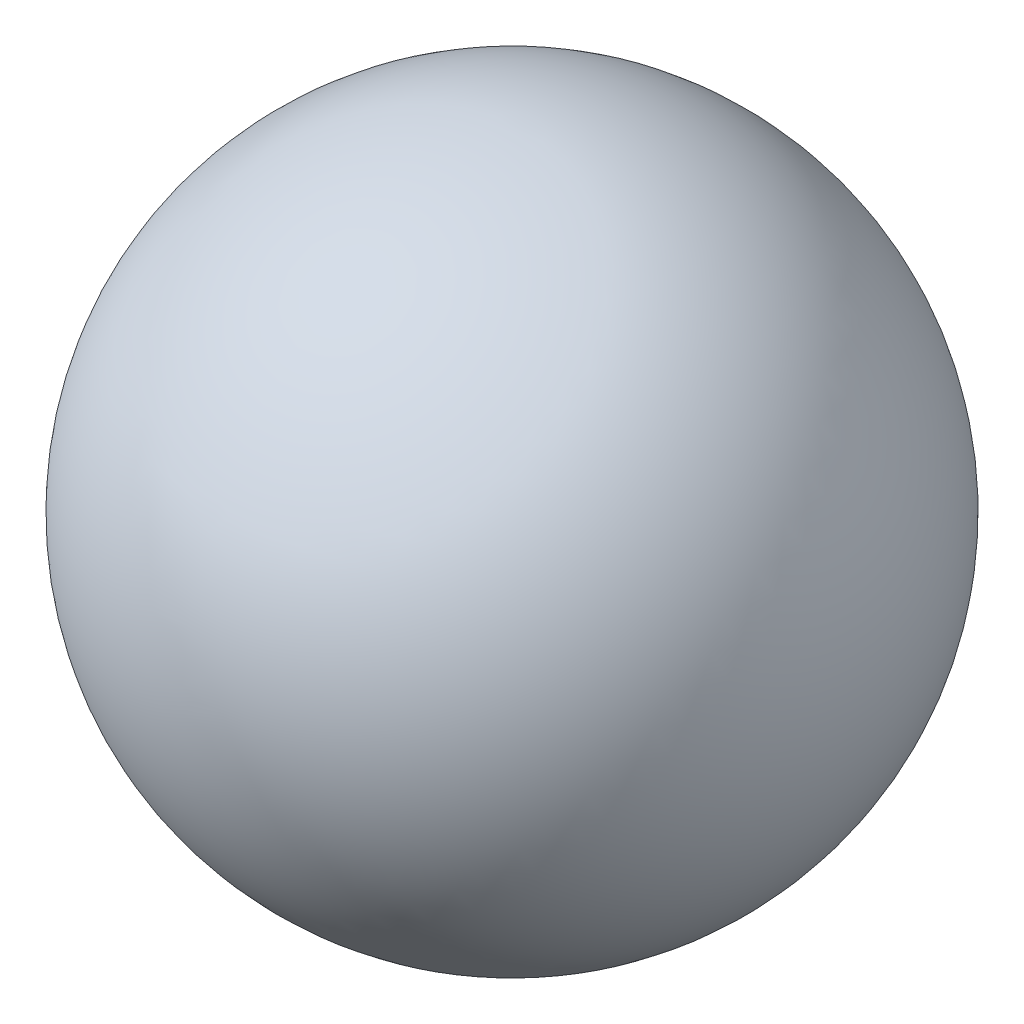
from build123d import *

# Parameters (mm, degrees)
SKETCH2_R           = 5
BOSS_EXTRUDE1_DEPTH = 95


with BuildPart() as part:
    # Sketch1 → Revolve3 (revolve)
    with BuildSketch(Plane(origin=(0, 0, 0), x_dir=(1, 0, 0), z_dir=(0, 1, 0))):
        with BuildLine():
            Line((0, 95), (0, -95))
            ThreePointArc((0, -95), (-95, 0), (0, 95))
        make_face()
    revolve(axis=Axis((0, 0, -95), (0, 0, 1)))


with BuildPart() as boss_extrude1_tool:
    # Sketch2 → Boss-Extrude1 (new body)
    with BuildSketch(Plane(origin=(0, 0, 0), x_dir=(1, 0, 0), z_dir=(0, 1, 0))):
        Circle(SKETCH2_R)
    extrude(amount=-BOSS_EXTRUDE1_DEPTH)


with BuildPart() as part_1:
    add(part.part)


with BuildPart() as part_2:
    # Boss-Extrude1: joined with boss_extrude1_tool
    add(part_1.part.fuse(boss_extrude1_tool.part, tol=0.00001))


solid = part_2.part
